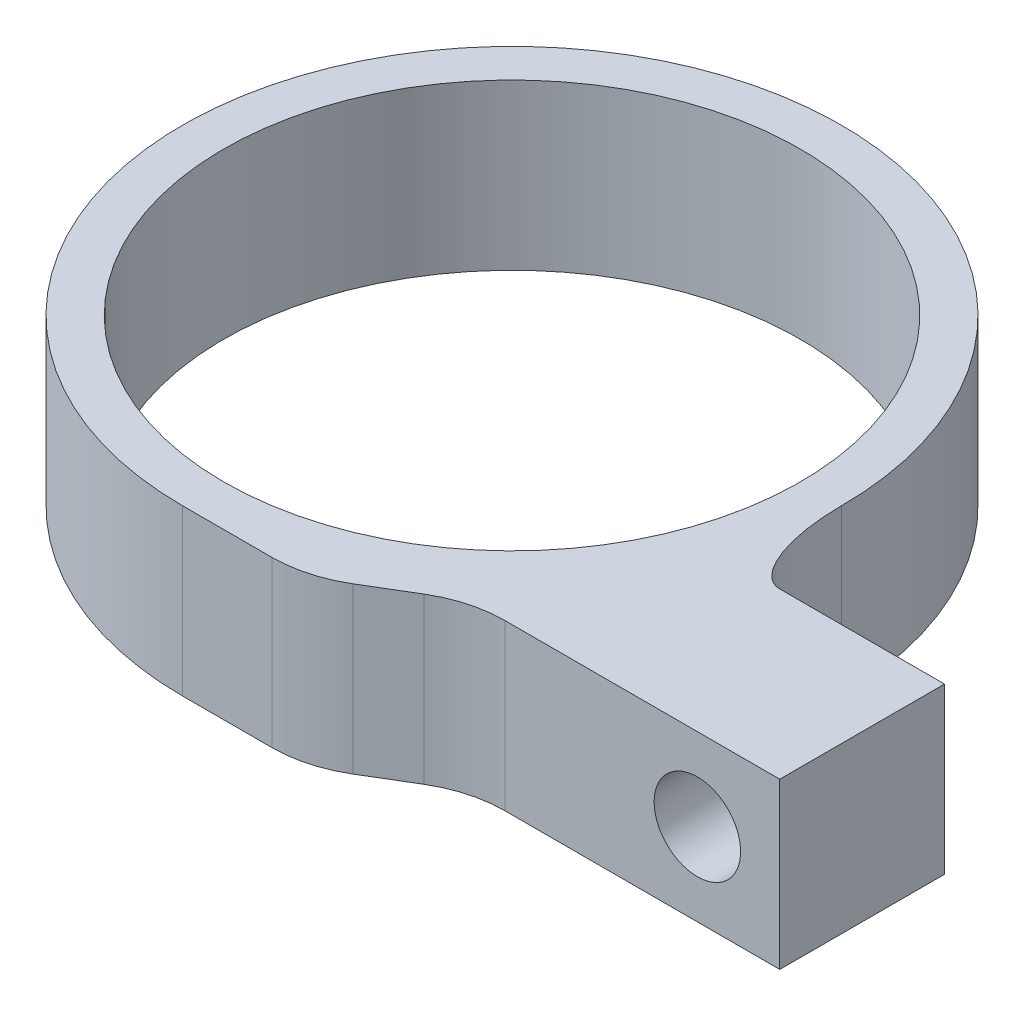
from build123d import *

# Parameters (mm, degrees)
SKETCH1_R           = 14
BOSS_EXTRUDE1_DEPTH = 8
FILLET2_R           = 6
SKETCH2_R           = 2.1
CUT_EXTRUDE1_DEPTH  = 35.365680555
FILLET3_SIZE        = 5
FILLET3_SIZE_2      = 2


with BuildPart() as part:
    # Sketch1 → Boss-Extrude1 (new body)
    with BuildSketch(Plane(origin=(0, 0, 0), x_dir=(1, 0, 0), z_dir=(0, 1, 0))):
        with BuildLine():
            Line((0, -16), (6, -16))
            Line((6, -16), (11, -13))
            Line((11, -13), (26, -13))
            Line((26, -13), (26, -5))
            Line((26, -5), (16, -5))
            Line((16, -5), (16, 0))
            ThreePointArc((16, 0), (-11.313708499, 11.313708499), (0, -16))
        make_face()
        with Locations(Location((0, 0, 0), (0, 0, 270))):
            Circle(SKETCH1_R, mode=Mode.SUBTRACT)
    extrude(amount=BOSS_EXTRUDE1_DEPTH)

    # Fillet2
    fillet2_edges = [part.edges().sort_by_distance(p)[0] for p in [
        (11, 4, 13),
        (6, 4, 16),
    ]]
    fillet(fillet2_edges, radius=FILLET2_R)

    # Sketch2 → Cut-Extrude1 (cut, through all)
    with BuildSketch(Plane(origin=(0, 0, 5), x_dir=(-1, 0, 0), z_dir=(0, 0, -1))):
        with Locations((-22, 4)):
            Circle(SKETCH2_R)
    extrude(amount=-CUT_EXTRUDE1_DEPTH, mode=Mode.SUBTRACT)

    # Fillet3
    # an asymmetric fillet: 5, 2 mm, written as the material it adds along each edge
    with BuildSketch(Plane(origin=(16, 0, 5), x_dir=(0, 0, -1), z_dir=(0, 1, 0))) as fillet3_piece_1:
        with BuildLine():
            Bezier((FILLET3_SIZE, 0), (0, 0), (0, -FILLET3_SIZE_2), weights=[1, 0.707106781, 1])
            Line((0, -FILLET3_SIZE_2), (0, 0))
            Line((0, 0), (FILLET3_SIZE, 0))
        make_face()
    extrude(amount=8)


solid = part.part
